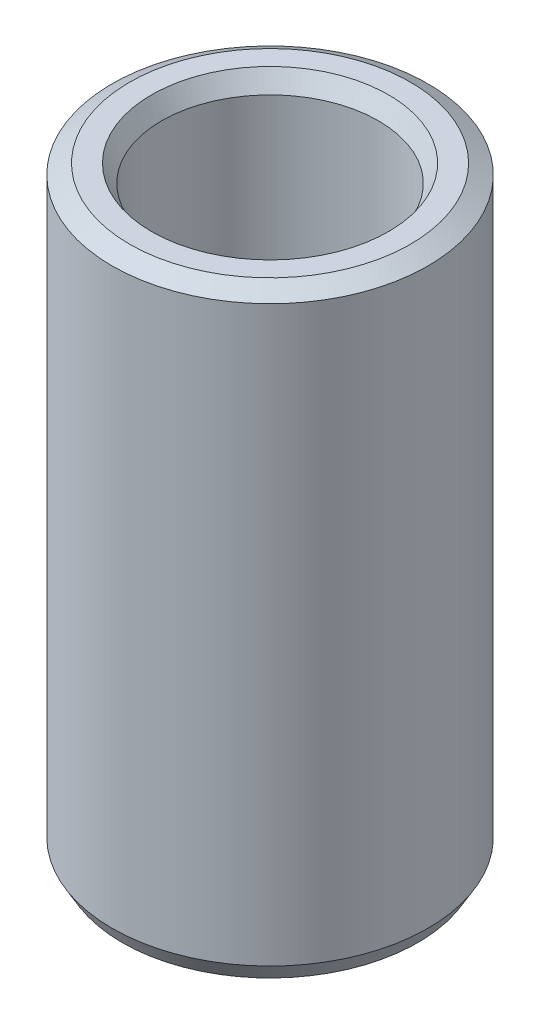
from build123d import *
from OCP.BRepFilletAPI import BRepFilletAPI_MakeChamfer

# Parameters (mm, degrees)
SKETCH1_R           = 50
BOSS_EXTRUDE1_DEPTH = 190.385845029
SKETCH2_R           = 34.337698619
CUT_EXTRUDE1_DEPTH  = 204.093008218
CHAMFER1_SIZE       = 3.19463183
CHAMFER1_SIZE2      = 5.533264641


with BuildPart() as part:
    # Sketch1 → Boss-Extrude1 (new body)
    with BuildSketch(Plane(origin=(0, 0, 0), x_dir=(1, 0, 0), z_dir=(0, 1, 0))):
        Circle(SKETCH1_R)
    extrude(amount=BOSS_EXTRUDE1_DEPTH)

    # Sketch2 → Cut-Extrude1 (cut, through all)
    with BuildSketch(Plane(origin=(0, 0, 0), x_dir=(1, 0, 0), z_dir=(0, 1, 0))):
        Circle(SKETCH2_R)
    extrude(amount=CUT_EXTRUDE1_DEPTH, mode=Mode.SUBTRACT)

    # Chamfer1: one chamfer whose edges measure the first distance from different faces: ONE call of the kernel's chamfer builder (chamfer() names one face for all edges)
    chamfer1_edges_1 = [part.edges().sort_by_distance(p)[0] for p in [
        (-34.337698619, 190.385845029, 0),
    ]]
    chamfer1_side_1 = [part.faces().sort_by_distance(p)[0] for p in [
        (-48.585786438, 190.385845029, 0),
    ]]
    chamfer1_edges_2 = [part.edges().sort_by_distance(p)[0] for p in [
        (-34.337698619, 0, 0),
    ]]
    chamfer1_side_2 = [part.faces().sort_by_distance(p)[0] for p in [
        (-34.337698619, 95.192922514, 0),
    ]]
    chamfer1_edges_3 = [part.edges().sort_by_distance(p)[0] for p in [
        (-50, 0, 0),
    ]]
    chamfer1_side_3 = [part.faces().sort_by_distance(p)[0] for p in [
        (-48.585786438, 0, 0),
    ]]
    chamfer1_edges_4 = [part.edges().sort_by_distance(p)[0] for p in [
        (-50, 190.385845029, 0),
    ]]
    chamfer1_side_4 = [part.faces().sort_by_distance(p)[0] for p in [
        (-50, 95.192922514, 0),
    ]]
    chamfer1 = BRepFilletAPI_MakeChamfer(part.part.solid().wrapped)
    for e in chamfer1_edges_1:
        chamfer1.Add(CHAMFER1_SIZE, CHAMFER1_SIZE2, e.wrapped, chamfer1_side_1[0].wrapped)  # the first distance lies on this face
    for e in chamfer1_edges_2:
        chamfer1.Add(CHAMFER1_SIZE, CHAMFER1_SIZE2, e.wrapped, chamfer1_side_2[0].wrapped)  # the first distance lies on this face
    for e in chamfer1_edges_3:
        chamfer1.Add(CHAMFER1_SIZE, CHAMFER1_SIZE2, e.wrapped, chamfer1_side_3[0].wrapped)  # the first distance lies on this face
    for e in chamfer1_edges_4:
        chamfer1.Add(CHAMFER1_SIZE, CHAMFER1_SIZE2, e.wrapped, chamfer1_side_4[0].wrapped)  # the first distance lies on this face
    add(Compound.cast(chamfer1.Shape()), mode=Mode.REPLACE)


solid = part.part
